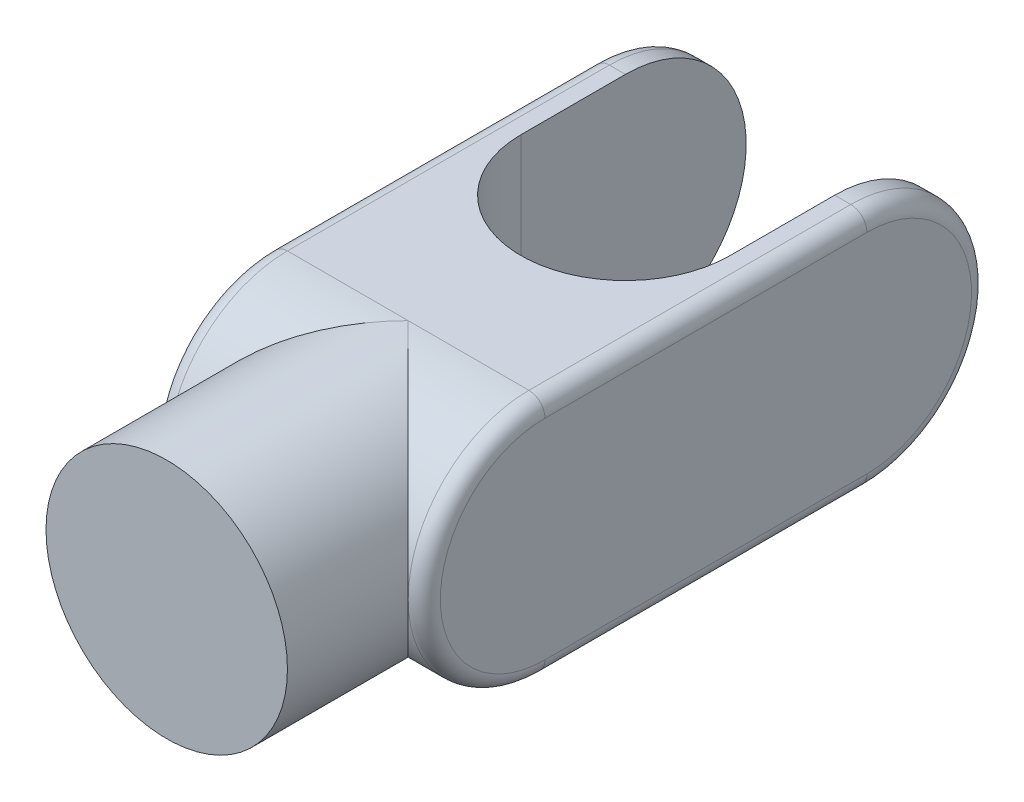
from build123d import *

# Parameters (mm, degrees)
SKETCH_1_R          = 150
EXTRUDE_1_DEPTH     = 150
EXTRUDE_2_DEPTH     = 170
FILLET_1_R          = 20
FILLET_2_R          = 20
CUT_EXTRUDE_1_DEPTH = 170


with BuildPart() as part:
    # 草图1 → 凸台-拉伸1 (new, symmetric)
    with BuildSketch(Plane.XY):
        Circle(SKETCH_1_R)
    extrude(amount=EXTRUDE_1_DEPTH, both=True)

    # 草图3 → 凸台-拉伸2 (add, symmetric)
    with BuildSketch(Plane(origin=(0, 0, 0), x_dir=(0, 0, -1), z_dir=(1, 0, 0))):
        with BuildLine():
            Line((150, 150), (550, 150))
            ThreePointArc((550, 150), (700, 0), (550, -150))
            Line((550, -150), (150, -150))
            ThreePointArc((150, -150), (0, 0), (150, 150))
        make_face()
    extrude(amount=EXTRUDE_2_DEPTH, both=True)

    # 圆角1
    fillet_1_edges = [part.edges().sort_by_distance(p)[0] for p in [
        (170, -150, -350),
        (170, 150, -350),
        (170, 0, 0),
        (170, 0, -700),
    ]]
    fillet(fillet_1_edges, radius=FILLET_1_R - 0.0001)  # a hair under: the kernel refuses the full size

    # 圆角2
    fillet_2_edges = [part.edges().sort_by_distance(p)[0] for p in [
        (-170, 0, 0),
        (-170, 0, -700),
        (-170, 150, -350),
        (-170, -150, -350),
    ]]
    fillet(fillet_2_edges, radius=FILLET_2_R - 0.0001)  # a hair under: the kernel refuses the full size

    # 草图4 → 切除-拉伸1 (cut, symmetric)
    with BuildSketch(Plane(origin=(0, 0, 0), x_dir=(1, 0, 0), z_dir=(0, 1, 0))):
        with BuildLine():
            Line((-130, 420), (-130, 938.530561272))
            Line((-130, 938.530561272), (130, 938.530561272))
            Line((130, 938.530561272), (130, 420))
            ThreePointArc((130, 420), (0, 290), (-130, 420))
        make_face()
    extrude(amount=CUT_EXTRUDE_1_DEPTH, both=True, mode=Mode.SUBTRACT)


solid = part.part
